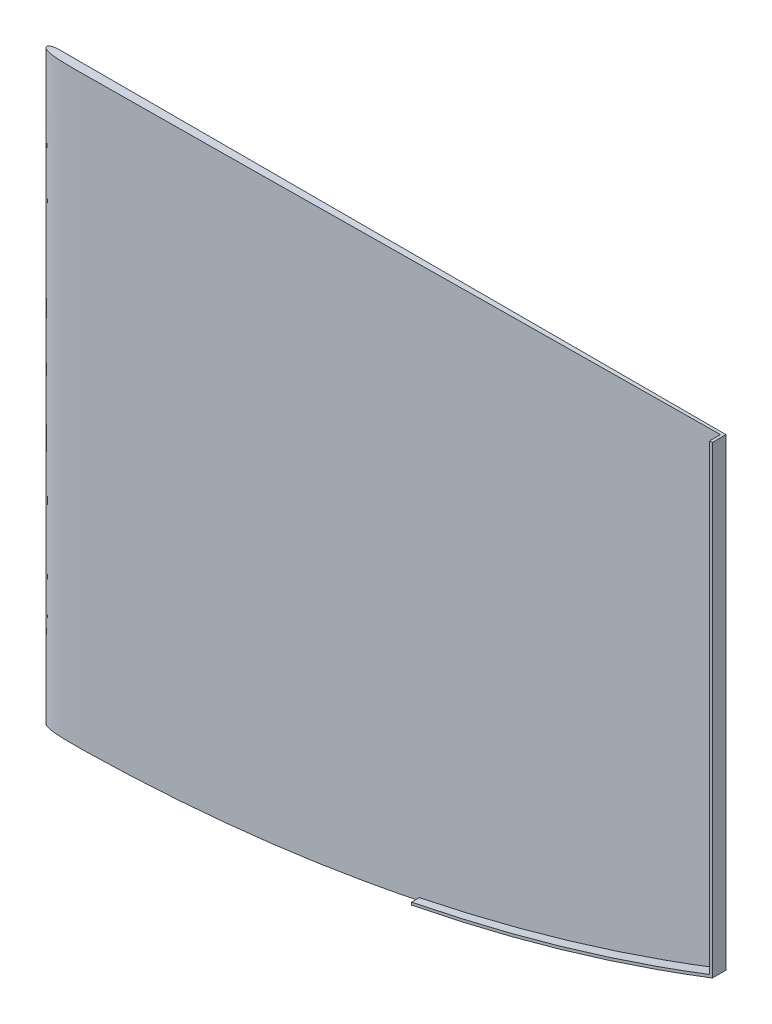
from build123d import *

# Parameters (mm, degrees)
EXTRUDE_1_DEPTH     = 325
CUT_EXTRUDE_START   = 0.467643307
CUT_EXTRUDE_1_DEPTH = 10.196163133
EXTRUDE_2_REACH     = 819.527
EXTRUDE_3_REACH     = 819.527


# Read off the part's stored shape, not the designer's step: 切除-拉伸1
with BuildPart() as part:
    # 草图1 → 凸台-拉伸1 (new, symmetric)
    with BuildSketch(Plane(origin=(0, 0, 0), x_dir=(1, 0, 0), z_dir=(0, 1, 0))):
        with BuildLine():
            Line((10, -0.467643307), (750, -0.467643307))
            Line((750, -0.467643307), (750, -3.467643307))
            add(Edge.make_bspline(
                [(10, -0.467643307), (2.716217609, -0.467643307), (-3.977358646, -4.217262467), (9.876528594, -12.267556836), (65.835750945, -10.451699609), (750, -3.467643307)],
                knots=[0, 0, 0, 0, 0.344535258, 0.623371845, 1, 1, 1, 1], degree=3))
        make_face()
    extrude(amount=EXTRUDE_1_DEPTH, both=True)

    # 切除-拉伸1 outline → 切除-拉伸1 (cut)
    with BuildSketch(Plane.XY.offset(CUT_EXTRUDE_START)):
        with BuildLine():
            add(Edge.make_bspline(
                [(46.925011271, -325), (411.018834777, -320.909352671), (750, -190)],
                knots=[0.060602183, 0.060602183, 0.060602183, 1, 1, 1], degree=2))
            Line((46.925011271, -325), (750, -325))
            Line((750, -325), (750, -190))
        make_face()
    extrude(amount=CUT_EXTRUDE_1_DEPTH, mode=Mode.SUBTRACT)

    # 草图3 → 凸台-拉伸2 (add, up to next)
    with BuildSketch(Plane(origin=(0, 0, 15.467643307), x_dir=(-1, 0, 0), z_dir=(0, 0, -1)), mode=Mode.PRIVATE) as extrude_2_sk1:
        with BuildLine():
            Line((-750, 325), (-750, -190))
            add(Edge.make_bspline(
                [(-747, -191.155881977), (-748.500245783, -190.57918219), (-750, -190)],
                knots=[0, 0, 0, 1, 1, 1], degree=2))
            Line((-747, -191.155881977), (-747, 325))
            Line((-747, 325), (-750, 325))
        make_face()
    extrude_2_tool1 = extrude(extrude_2_sk1.sketch, amount=EXTRUDE_2_REACH, mode=Mode.PRIVATE) - part.part
    add(extrude_2_tool1.solids().sort_by_distance((748.49944, 67.210699, 15.467643))[0])

    # 草图4 → 凸台-拉伸3 (add, up to next)
    with BuildSketch(Plane(origin=(0, 0, 15.467643307), x_dir=(-1, 0, 0), z_dir=(0, 0, -1)), mode=Mode.PRIVATE) as extrude_3_sk1:
        with BuildLine():
            Line((-415.998579589, -287.009213098), (-415.998579589, -284.009213098))
            add(Edge.make_bspline(
                [(-415.998579589, -284.009213098), (-584.386896167, -250.664934415), (-747.000000045, -188.15588196)],
                knots=[0.518314736, 0.518314736, 0.518314736, 1, 1, 1], degree=2))
            Line((-747.000000045, -188.15588196), (-747.000000045, -191.15588196))
            add(Edge.make_bspline(
                [(-415.998579589, -287.009213098), (-584.386896167, -253.664934415), (-747.000000045, -191.15588196)],
                knots=[0.518314736, 0.518314736, 0.518314736, 1, 1, 1], degree=2))
        make_face()
    extrude_3_tool1 = extrude(extrude_3_sk1.sketch, amount=EXTRUDE_3_REACH, mode=Mode.PRIVATE) - part.part
    add(extrude_3_tool1.solids().sort_by_distance((583.461704, -245.863812, 15.467643))[0])


solid = part.part
